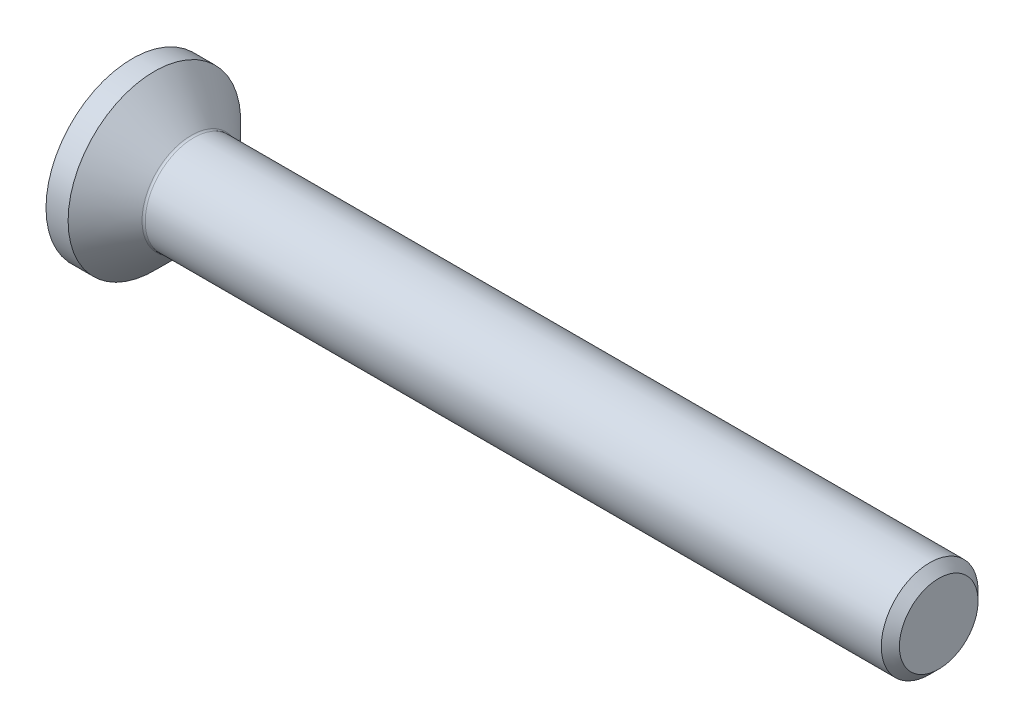
from build123d import *

# Parameters (mm, degrees)
FILLET1_R   = 0.1
HEX_START   = -1.1
HEX_2_DEPTH = 1.1


with BuildPart() as part:
    # BodySke → BaseBody (revolve)
    with BuildSketch(Plane.XY, mode=Mode.PRIVATE) as basebody_sk:
        Polygon((0, 0), (0, 2.675), (0.685, 2.675), (1.86, 1.5), (24.7195, 1.5), (25, 1.2195), (25, 0), align=None)
    revolve(basebody_sk.sketch.rotate(Axis((0, 0, 0), (1, 0, 0)), 90), axis=Axis((0, 0, 0), (1, 0, 0)))

    # Fillet1
    fillet1_edges = [part.edges().sort_by_distance(p)[0] for p in [
        (1.86, 0, -1.5),
    ]]
    fillet(fillet1_edges, radius=FILLET1_R)

    # Hex 2: read off the stored shape, not the designer's step
    # Hex 2 outline → Hex 2 (cut)
    with BuildSketch(Plane.ZY.offset(HEX_START)):
        Polygon((-1, -0.577350269), (0, -1.154700538), (1, -0.577350269), (1, 0.577350269), (0, 1.154700538), (-1, 0.577350269), align=None)
    extrude(amount=HEX_2_DEPTH, mode=Mode.SUBTRACT)

    # Hex 2 2 outline → Hex 2 2 (revolve, cut)
    with BuildSketch(Plane.YX):
        Polygon((1, 1.1), (0, 1.677350269), (0, 1.1), align=None)
    revolve(axis=Axis((0, 0, 0), (1, 0, 0)), mode=Mode.SUBTRACT)


solid = part.part
